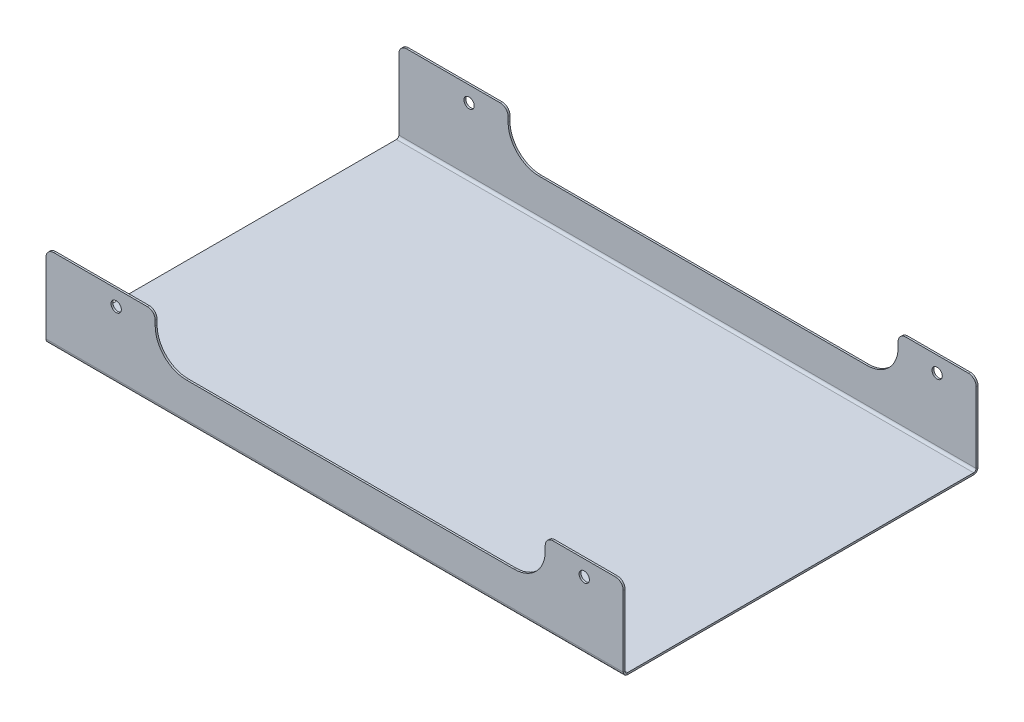
from build123d import *

# Parameters (mm, degrees)
SKETCH_1_W                         = 370
SKETCH_1_H                         = 1.2
SM_BASE_FLANGE_1_DEPTH             = 225
SM_EDGE_FLANGE_1_STRIP_W           = 8
SM_EDGE_FLANGE_1_STRIP_H           = 1.2
SM_EDGE_FLANGE_1_STRIP_CUT_DEPTH   = 370
SM_EDGE_FLANGE_1_STRIP_2_W         = 8
SM_EDGE_FLANGE_1_STRIP_2_H         = 1.2
SM_EDGE_FLANGE_1_STRIP_CUT_2_DEPTH = 370
SM_EDGE_FLANGE_1_DEPTH             = 370
SM_EDGE_FLANGE_1_BEND_DEPTH        = 370
CUT_EXTRUDE_1_DEPTH                = 438.395427502
FILLET_1_R                         = 5
SKETCH_17_R                        = 3.3
CUT_EXTRUDE_2_DEPTH                = 438.395427502


# Sheet-metal steps are written as plain solids
with BuildPart() as part:
    # Sketch 1 → Базовая кромка1 (new body)
    with BuildSketch(Plane.XY):
        with Locations((185, -0.6)):
            Rectangle(SKETCH_1_W, SKETCH_1_H)
    extrude(amount=SM_BASE_FLANGE_1_DEPTH)

    # Ребро-кромка1 strip (across the edge) → Ребро-кромка1 strip cut (cut)
    with BuildSketch(Plane(origin=(0, 0, 225), x_dir=(0, 0, -1), z_dir=(1, 0, 0))):
        with Locations((-2.4, -0.6)):
            Rectangle(SM_EDGE_FLANGE_1_STRIP_W, SM_EDGE_FLANGE_1_STRIP_H)
    extrude(amount=SM_EDGE_FLANGE_1_STRIP_CUT_DEPTH, mode=Mode.SUBTRACT)

    # Ребро-кромка1 strip 2 (across the edge) → Ребро-кромка1 strip cut 2 (cut)
    with BuildSketch(Plane.ZY.offset(-370)):
        with Locations((-2.4, -0.6)):
            Rectangle(SM_EDGE_FLANGE_1_STRIP_2_W, SM_EDGE_FLANGE_1_STRIP_2_H)
    extrude(amount=SM_EDGE_FLANGE_1_STRIP_CUT_2_DEPTH, mode=Mode.SUBTRACT)

    # Ребро-кромка1 section (across the edge) → Ребро-кромка1 (add)
    with BuildSketch(Plane(origin=(0, 0, 225), x_dir=(0, 0, -1), z_dir=(1, 0, 0))):
        with BuildLine():
            Line((-1.2, 1.6), (-1.2, 52))
            Line((-1.2, 52), (0, 52))
            Line((0, 52), (0, 1.6))
            ThreePointArc((0, 1.6), (0.46862915, 0.46862915), (1.6, 0))
            Line((1.6, 0), (1.6, -1.2))
            ThreePointArc((1.6, -1.2), (-0.379898987, -0.379898987), (-1.2, 1.6))
        make_face()
    extrude(amount=SM_EDGE_FLANGE_1_DEPTH)

    # Ребро-кромка1 section 2 (across the edge) → Ребро-кромка1 bend (add)
    with BuildSketch(Plane.ZY.offset(-370)):
        with BuildLine():
            Line((-1.2, 1.6), (-1.2, 52))
            Line((-1.2, 52), (0, 52))
            Line((0, 52), (0, 1.6))
            ThreePointArc((0, 1.6), (0.46862915, 0.46862915), (1.6, 0))
            Line((1.6, 0), (1.6, -1.2))
            ThreePointArc((1.6, -1.2), (-0.379898987, -0.379898987), (-1.2, 1.6))
        make_face()
    extrude(amount=SM_EDGE_FLANGE_1_BEND_DEPTH)

    # Эскиз14 → Вырез-Вытянуть1 (cut, through all)
    with BuildSketch(Plane.XY.offset(226.2)):
        with BuildLine():
            Line((70, 52), (320, 52))
            Line((320, 52), (320, 43.8))
            ThreePointArc((320, 43.8), (314.142135624, 29.657864376), (300, 23.8))
            Line((300, 23.8), (90, 23.8))
            ThreePointArc((90, 23.8), (75.857864376, 29.657864376), (70, 43.8))
            Line((70, 43.8), (70, 52))
        make_face()
    extrude(amount=-CUT_EXTRUDE_1_DEPTH, mode=Mode.SUBTRACT)

    # Скругление1
    fillet_1_edges = [part.edges().sort_by_distance(p)[0] for p in [
        (0, 52, 225.6),
        (370, 52, 225.6),
        (370, 52, -0.6),
        (0, 52, -0.6),
        (70, 52, 225.6),
        (320, 52, 225.6),
        (70, 52, -0.6),
        (320, 52, -0.6),
    ]]
    fillet(fillet_1_edges, radius=FILLET_1_R)

    # Эскиз17 → Вырез-Вытянуть2 (cut, through all)
    with BuildSketch(Plane(origin=(0, 0, -1.2), x_dir=(-1, 0, 0), z_dir=(0, 0, -1))):
        with Locations(Location((-345, 42, 0), (0, 0, 90))):
            Circle(SKETCH_17_R)
        with Locations(Location((-45, 42, 0), (0, 0, 90))):
            Circle(SKETCH_17_R)
    extrude(amount=-CUT_EXTRUDE_2_DEPTH, mode=Mode.SUBTRACT)


solid = part.part
